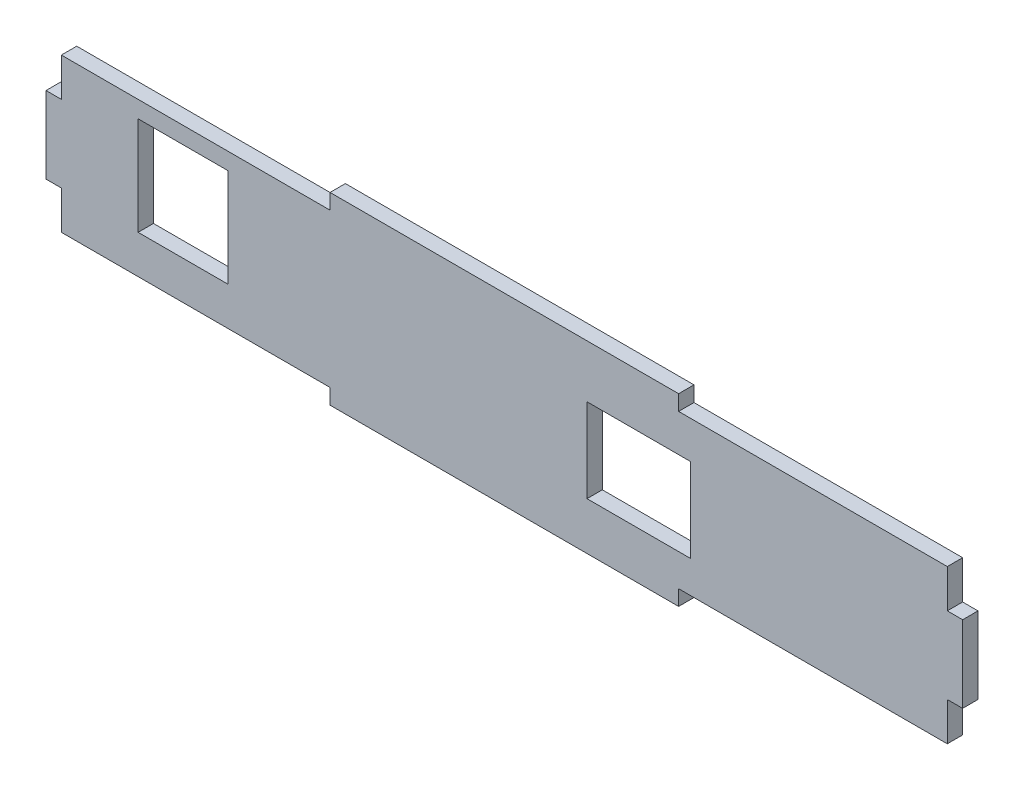
from build123d import *

# Parameters (mm, degrees)
SKETCH1_W           = 13.456627606
SKETCH1_H           = 10.933385467
SKETCH1_W_2         = 11.695168442
SKETCH1_H_2         = 12.807944464
BOSS_EXTRUDE1_DEPTH = 2


with BuildPart() as part:
    # Sketch1 → Boss-Extrude1 (new body)
    with BuildSketch(Plane.XY):
        Polygon((0, 0), (35, 0), (35, -2.000471596), (80.41, -2.000471596), (80.41, 0), (115.41, 0), (115.41, 5), (117.41, 5), (117.41, 15), (115.41, 15), (115.41, 20), (80.41, 20), (80.41, 22), (35, 22), (35, 20), (0, 20), (0, 15), (-2, 15), (-2, 5), (0, 5), align=None)
        with Locations((75.201406971, 9.655909702)):
            Rectangle(SKETCH1_W, SKETCH1_H, mode=Mode.SUBTRACT)
        with Locations((15.847584221, 11.403972232)):
            Rectangle(SKETCH1_W_2, SKETCH1_H_2, mode=Mode.SUBTRACT)
    extrude(amount=BOSS_EXTRUDE1_DEPTH)


solid = part.part
